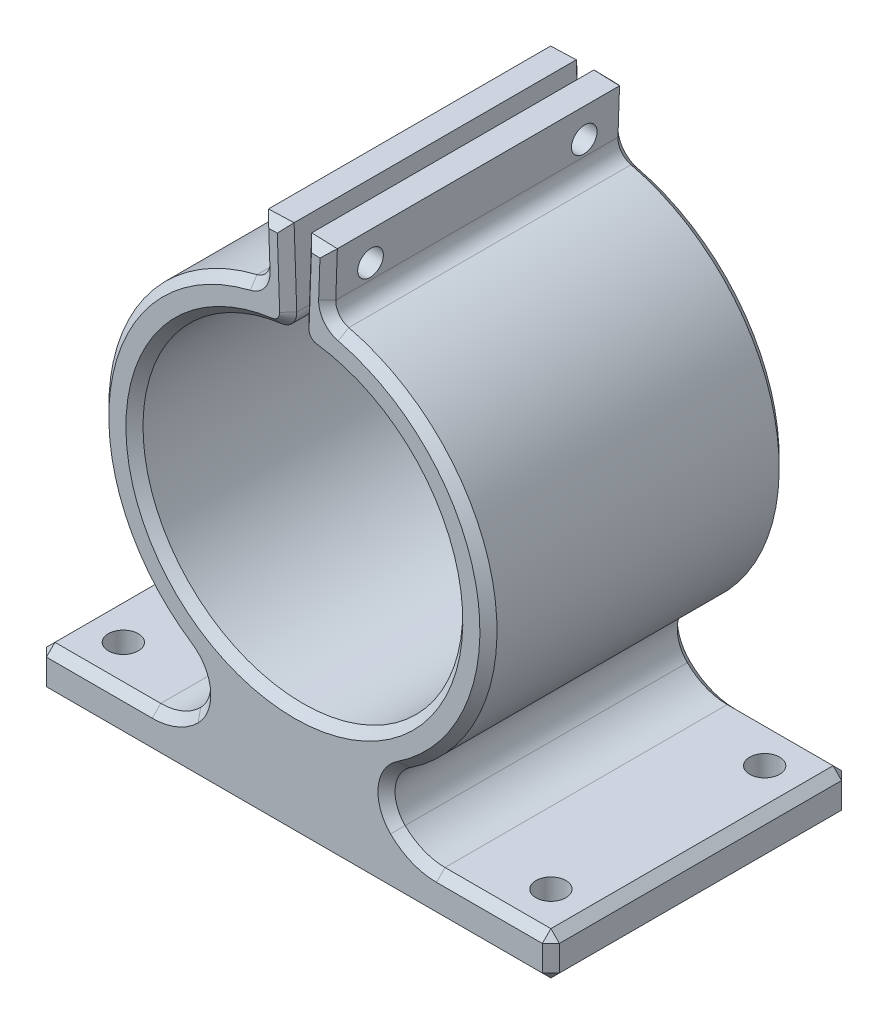
from build123d import *

# Parameters (mm, degrees)
BOSS_EXTRUDE1_DEPTH     = 35
CUT_EXTRUDE1_DEPTH      = 57.115951386
CUT_EXTRUDE1_DEPTH_BACK = 57.115951386
SKETCH2_R               = 1.5
SKETCH3_R               = 1.75
CUT_EXTRUDE2_DEPTH      = 73.906241125
FILLET1_R               = 4
FILLET2_R               = 2
CHAMFER1_SIZE           = 1


with BuildPart() as part:
    # Sketch1 → Boss-Extrude1 (new body)
    with BuildSketch(Plane.XY):
        with BuildLine():
            Line((-0.652620588, 18.688608465), (-1.029566174, 29.482917727))
            Line((-1.029566174, 29.482917727), (-4.027738655, 29.378219237))
            Line((-4.027738655, 29.378219237), (-3.783442178, 22.382483448))
            ThreePointArc((-3.783442178, 22.382483448), (-22.463854977, 3.265764775), (-10, -20.378665314))
            ThreePointArc((-10, -20.378665314), (-11.939344029, -25.060655971), (-16.621334686, -27))
            Line((-16.621334686, -27), (-30, -27))
            Line((-30, -27), (-30, -32))
            Line((-30, -32), (30, -32))
            Line((30, -32), (30, -27))
            Line((30, -27), (16.621334686, -27))
            ThreePointArc((16.621334686, -27), (11.939344029, -25.060655971), (10, -20.378665314))
            ThreePointArc((10, -20.378665314), (22.463854977, 3.265764775), (3.783442178, 22.382483448))
            Line((3.783442178, 22.382483448), (4.027738655, 29.378219237))
            Line((4.027738655, 29.378219237), (1.029566174, 29.482917727))
            Line((1.029566174, 29.482917727), (0.652620588, 18.688608465))
            ThreePointArc((0.652620588, 18.688608465), (0, -18.7), (-0.652620588, 18.688608465))
        make_face()
    extrude(amount=BOSS_EXTRUDE1_DEPTH)

    # Sketch2 → Cut-Extrude1 (cut, two sides: drawn at the far end of the back side and taken through both)
    with BuildSketch(Plane(origin=(0, 0, 0), x_dir=(0, 0, -1), z_dir=(1, 0, 0)).offset(-CUT_EXTRUDE1_DEPTH_BACK)):
        with Locations((-30, 25.880351342)):
            Circle(SKETCH2_R)
        with Locations((-5, 25.880351342)):
            Circle(SKETCH2_R)
    extrude(amount=CUT_EXTRUDE1_DEPTH + CUT_EXTRUDE1_DEPTH_BACK, mode=Mode.SUBTRACT)

    # Sketch3 → Cut-Extrude2 (cut, through all)
    with BuildSketch(Plane(origin=(0, -27, 0), x_dir=(1, 0, 0), z_dir=(0, 1, 0))):
        with Locations((-25, -5)):
            Circle(SKETCH3_R)
        with Locations((-25, -30)):
            Circle(SKETCH3_R)
        with Locations((25, -30)):
            Circle(SKETCH3_R)
        with Locations((25, -5)):
            Circle(SKETCH3_R)
    extrude(amount=-CUT_EXTRUDE2_DEPTH, mode=Mode.SUBTRACT)

    # Fillet1
    fillet1_edges = [part.edges().sort_by_distance(p)[0] for p in [
        (-10, -20.378665314, 17.5),
        (10, -20.378665314, 17.5),
    ]]
    fillet(fillet1_edges, radius=FILLET1_R)

    # Fillet2
    fillet2_edges = [part.edges().sort_by_distance(p)[0] for p in [
        (3.783442178, 22.382483448, 17.5),
        (-0.652620588, 18.688608465, 17.5),
        (0.652620588, 18.688608465, 17.5),
        (-3.783442178, 22.382483448, 17.5),
    ]]
    fillet(fillet2_edges, radius=FILLET2_R)

    # Chamfer1
    chamfer1_edges = [part.edges().sort_by_distance(p)[0] for p in [
        (30, -29.5, 0),
        (23.310667343, -27, 0),
        (14.099306205, -26.500874504, 0),
        (3.935041139, 26.723709689, 0),
        (2.528652414, 29.430568482, 0),
        (0.874302959, 25.03676097, 0),
        (0, -18.7, 0),
        (-0.874302959, 25.03676097, 0),
        (-2.528652414, 29.430568482, 0),
        (-3.935041139, 26.723709689, 0),
        (-14.099306205, -26.500874504, 0),
        (-23.310667343, -27, 0),
        (-30, -29.5, 0),
        (0, -32, 0),
        (-30, -29.5, 35),
        (-23.310667343, -27, 35),
        (-14.099306205, -26.500874504, 35),
        (-3.935041139, 26.723709689, 35),
        (-2.528652414, 29.430568482, 35),
        (-0.874302959, 25.03676097, 35),
        (0, -18.7, 35),
        (0.874302959, 25.03676097, 35),
        (2.528652414, 29.430568482, 35),
        (3.935041139, 26.723709689, 35),
        (14.099306205, -26.500874504, 35),
        (23.310667343, -27, 35),
        (30, -29.5, 35),
        (0, -32, 35),
        (-4.247231716, 22.791302098, 0),
        (-22.357902089, 3.926094008, 0),
        (-10.793982585, -21.849764719, 0),
        (10.793982585, -21.849764719, 0),
        (22.357902089, 3.926094008, 0),
        (4.247231716, 22.791302098, 0),
        (1.190855047, 19.229149784, 0),
        (-1.190855047, 19.229149784, 0),
        (1.190855047, 19.229149784, 35),
        (4.247231716, 22.791302098, 35),
        (22.357902089, 3.926094008, 35),
        (10.793982585, -21.849764719, 35),
        (-10.793982585, -21.849764719, 35),
        (-22.357902089, 3.926094008, 35),
        (-4.247231716, 22.791302098, 35),
        (-1.190855047, 19.229149784, 35),
        (-30, -27, 17.5),
        (-30, -32, 17.5),
        (30, -32, 17.5),
        (30, -27, 17.5),
    ]]
    chamfer(chamfer1_edges, length=CHAMFER1_SIZE)


solid = part.part
